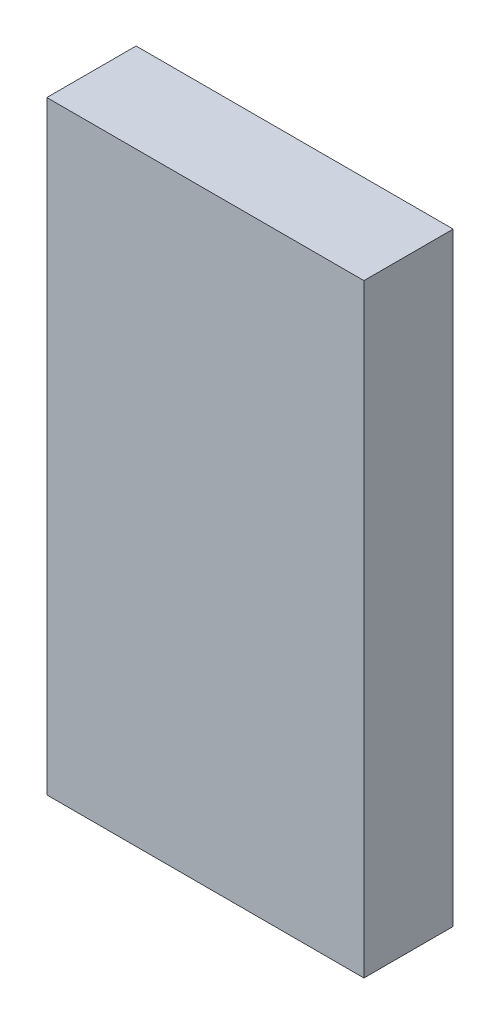
from build123d import *

# Parameters (mm, degrees)
ESQUISSE1_W        = 53.3
ESQUISSE1_H        = 101.52
BOSS_EXTRU_1_DEPTH = 15


with BuildPart() as part:
    # Esquisse1 → Boss.-Extru.1 (new body)
    with BuildSketch(Plane.XY):
        with Locations((26.65, 50.76)):
            Rectangle(ESQUISSE1_W, ESQUISSE1_H)
    extrude(amount=BOSS_EXTRU_1_DEPTH)


solid = part.part
